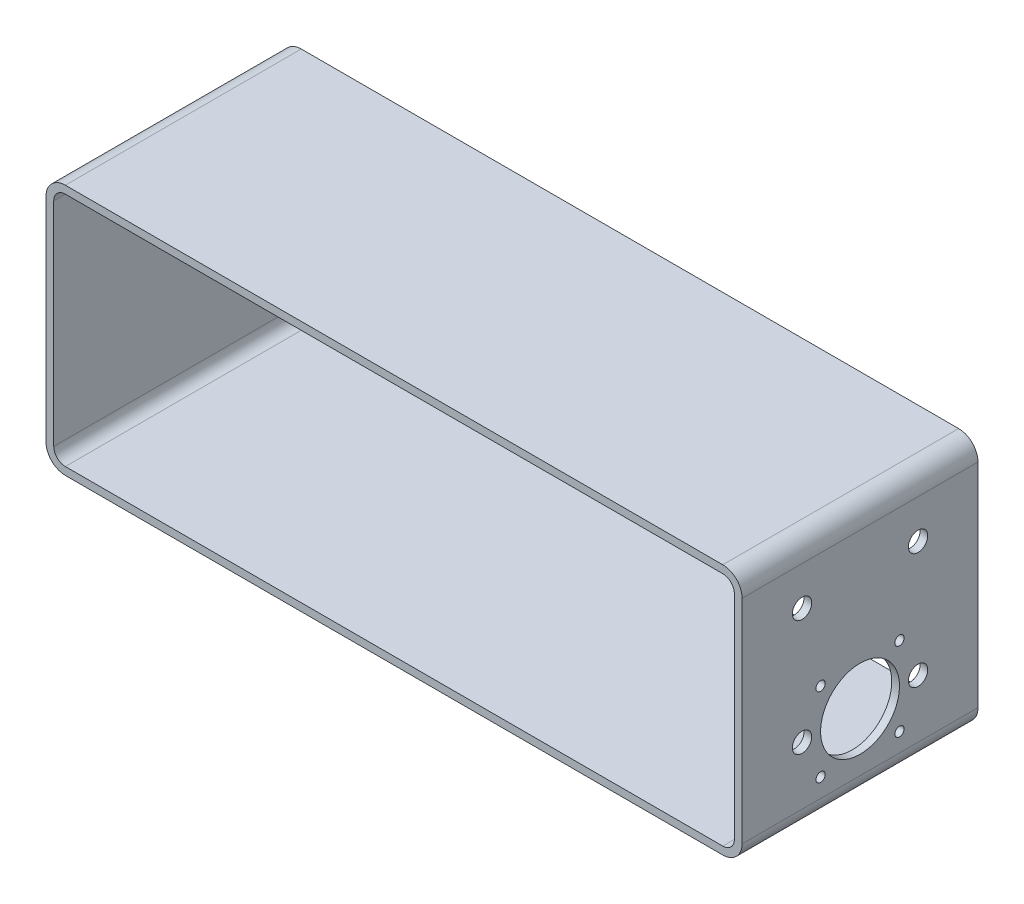
from build123d import *

# Parameters (mm, degrees)
SKETCH3_R               = 3.175
SKETCH3_R_2             = 3.429
BOSS_EXTRUDE1_DEPTH     = 77.47
CUT_EXTRUDE1_DEPTH      = 145.117023717
CUT_EXTRUDE1_DEPTH_BACK = 145.117023717
SKETCH4_R               = 3.175
SKETCH4_R_2             = 3.429
SKETCH6_R               = 3.175
SKETCH6_R_2             = 1.524
SKETCH6_R_3             = 12.954
CUT_EXTRUDE3_DEPTH      = 15.24


with BuildPart() as part:
    # Sketch3 → Boss-Extrude1 (new body)
    with BuildSketch(Plane.XY):
        with BuildLine():
            Line((107.95, -41.275), (-107.95, -41.275))
            ThreePointArc((-107.95, -41.275), (-112.440128061, -39.415128061), (-114.3, -34.925))
            Line((-114.3, -34.925), (-114.3, 34.925))
            ThreePointArc((-114.3, 34.925), (-112.440128061, 39.415128061), (-107.95, 41.275))
            Line((-107.95, 41.275), (107.95, 41.275))
            ThreePointArc((107.95, 41.275), (112.440128061, 39.415128061), (114.3, 34.925))
            Line((114.3, 34.925), (114.3, -34.925))
            ThreePointArc((114.3, -34.925), (112.440128061, -39.415128061), (107.95, -41.275))
        make_face()
        with Locations((-107.95, 34.925)):
            Circle(SKETCH3_R, mode=Mode.SUBTRACT)
        with Locations((-107.95, -34.925)):
            Circle(SKETCH3_R, mode=Mode.SUBTRACT)
        with Locations((107.95, -34.925)):
            Circle(SKETCH3_R, mode=Mode.SUBTRACT)
        with Locations((107.95, 34.925)):
            Circle(SKETCH3_R, mode=Mode.SUBTRACT)
        with Locations((-85.598, 0)):
            Circle(SKETCH3_R_2, mode=Mode.SUBTRACT)
        with Locations((85.598, 0)):
            Circle(SKETCH3_R_2, mode=Mode.SUBTRACT)
        with Locations((-15.875, 5.732638889)):
            Circle(SKETCH3_R, mode=Mode.SUBTRACT)
        with Locations((15.875, 5.732638889)):
            Circle(SKETCH3_R, mode=Mode.SUBTRACT)
        with Locations((15.875, -5.732638889)):
            Circle(SKETCH3_R, mode=Mode.SUBTRACT)
        with Locations((-15.875, -5.732638889)):
            Circle(SKETCH3_R, mode=Mode.SUBTRACT)
    extrude(amount=BOSS_EXTRUDE1_DEPTH)

    # Sketch4 → Cut-Extrude1 (cut, two sides: drawn at the far end of the back side and taken through both)
    with BuildSketch(Plane.XY.offset(77.47).offset(-CUT_EXTRUDE1_DEPTH_BACK)):
        with BuildLine():
            ThreePointArc((111.76, 34.925), (110.644076836, 37.619076836), (107.95, 38.735))
            Line((107.95, 38.735), (-107.95, 38.735))
            ThreePointArc((-107.95, 38.735), (-110.644076836, 37.619076836), (-111.76, 34.925))
            Line((-111.76, 34.925), (-111.76, -34.925))
            ThreePointArc((-111.76, -34.925), (-110.644076836, -37.619076836), (-107.95, -38.735))
            Line((-107.95, -38.735), (107.95, -38.735))
            ThreePointArc((107.95, -38.735), (110.644076836, -37.619076836), (111.76, -34.925))
            Line((111.76, -34.925), (111.76, 34.925))
        make_face()
        with Locations((-15.875, -5.732638889)):
            Circle(SKETCH4_R, mode=Mode.SUBTRACT)
        with Locations((15.875, -5.732638889)):
            Circle(SKETCH4_R, mode=Mode.SUBTRACT)
        with Locations((-85.598, 0)):
            Circle(SKETCH4_R_2, mode=Mode.SUBTRACT)
        with Locations((-15.875, 5.732638889)):
            Circle(SKETCH4_R, mode=Mode.SUBTRACT)
        with Locations((15.875, 5.732638889)):
            Circle(SKETCH4_R, mode=Mode.SUBTRACT)
        with Locations((85.598, 0)):
            Circle(SKETCH4_R_2, mode=Mode.SUBTRACT)
    extrude(amount=CUT_EXTRUDE1_DEPTH + CUT_EXTRUDE1_DEPTH_BACK, mode=Mode.SUBTRACT)

    # Sketch6 → Cut-Extrude3 (cut)
    with BuildSketch(Plane(origin=(114.3, 0, 0), x_dir=(0, 0, -1), z_dir=(1, 0, 0))):
        with Locations((-57.785, 22.225)):
            Circle(SKETCH6_R)
        with Locations((-19.685, 22.225)):
            Circle(SKETCH6_R)
        with Locations((-19.685, -15.875)):
            Circle(SKETCH6_R)
        with Locations((-57.785, -15.875)):
            Circle(SKETCH6_R)
        with Locations((-51.689, -2.921)):
            Circle(SKETCH6_R_2)
        with Locations((-25.781, -2.921)):
            Circle(SKETCH6_R_2)
        with Locations((-25.781, -28.829)):
            Circle(SKETCH6_R_2)
        with Locations((-51.689, -28.829)):
            Circle(SKETCH6_R_2)
        with Locations((-38.735, -15.875)):
            Circle(SKETCH6_R_3)
    extrude(amount=-CUT_EXTRUDE3_DEPTH, mode=Mode.SUBTRACT)


solid = part.part
